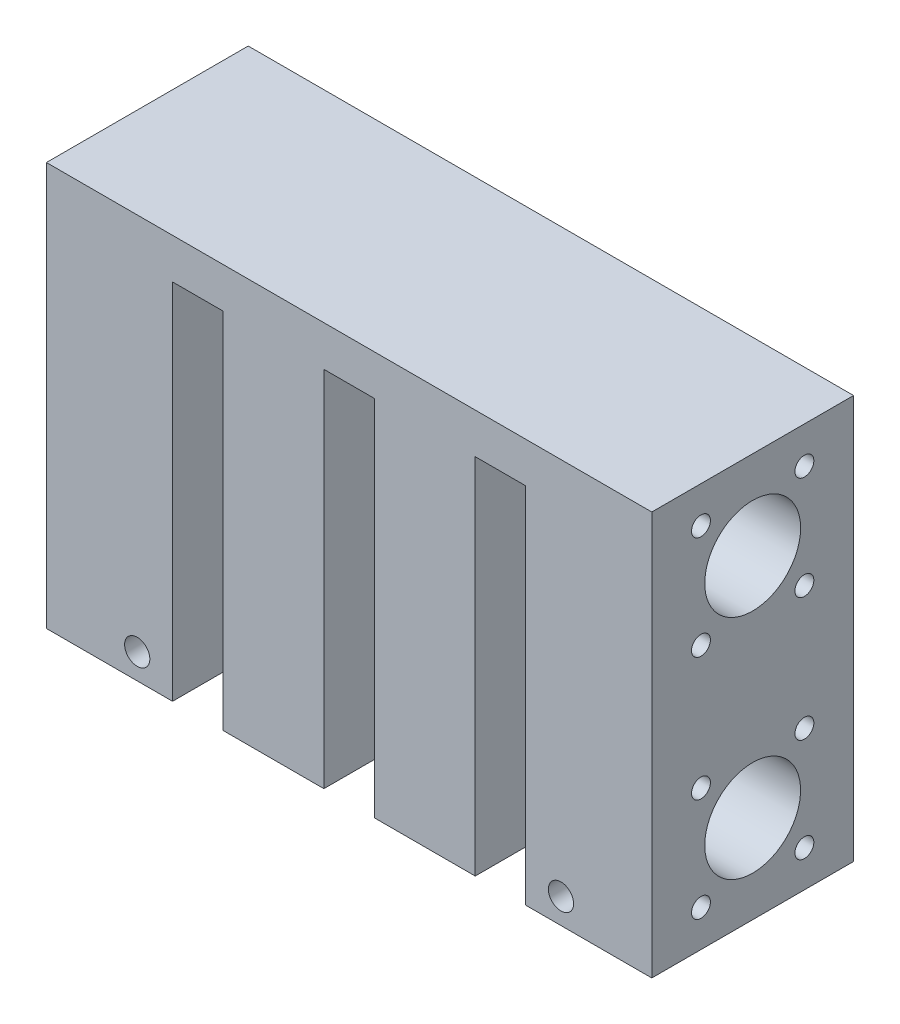
from build123d import *

# Parameters (mm, degrees)
SKETCH1_W                        = 120
SKETCH1_H                        = 80
BOSS_EXTRUDE1_DEPTH              = 40
SKETCH2_R                        = 1.85
LINEAR_BEARING_SCREW_CUTS_DEPTH  = 14
SKETCH3_R                        = 9.5
LINEAR_BEARINGS_HOLE_DEPTH       = 55
SKETCH4_R                        = 1.875
LINEAR_BEARING_SCREW_CUTS2_DEPTH = 14
CUT_EXTRUDE4_START               = -55
SKETCH5_R                        = 9.5
CUT_EXTRUDE4_DEPTH               = 55
SKETCH10_W                       = 10
SKETCH10_H                       = 10
CUT_EXTRUDE8_DEPTH               = 72
SKETCH11_R                       = 6
CUT_EXTRUDE9_DEPTH               = 111.566721937
SKETCH13_R                       = 2.5
CUT_EXTRUDE11_DEPTH              = 150.666295471


with BuildPart() as part:
    # Sketch1 → Boss-Extrude1 (new body)
    with BuildSketch(Plane.XY):
        with Locations((60, 40)):
            Rectangle(SKETCH1_W, SKETCH1_H)
    extrude(amount=BOSS_EXTRUDE1_DEPTH)

    # Sketch2 → linear-bearing-screw-cuts (cut)
    with BuildSketch(Plane.ZY):
        with Locations((30.25, 72.75)):
            Circle(SKETCH2_R)
        with Locations((9.75, 72.75)):
            Circle(SKETCH2_R)
        with Locations((30.25, 52.25)):
            Circle(SKETCH2_R)
        with Locations((9.75, 52.25)):
            Circle(SKETCH2_R)
        with Locations((9.75, 27.75)):
            Circle(SKETCH2_R)
        with Locations((30.25, 27.75)):
            Circle(SKETCH2_R)
        with Locations((30.25, 7.25)):
            Circle(SKETCH2_R)
        with Locations((9.75, 7.25)):
            Circle(SKETCH2_R)
    extrude(amount=-LINEAR_BEARING_SCREW_CUTS_DEPTH, mode=Mode.SUBTRACT)

    # Sketch3 → linear-bearings-hole (cut)
    with BuildSketch(Plane.ZY):
        with Locations((20, 62.5)):
            Circle(SKETCH3_R)
        with Locations((20, 17.5)):
            Circle(SKETCH3_R)
    extrude(amount=-LINEAR_BEARINGS_HOLE_DEPTH, mode=Mode.SUBTRACT)

    # Sketch4 → linear-bearing-screw-cuts2 (cut)
    with BuildSketch(Plane(origin=(120, 0, 0), x_dir=(0, 0, -1), z_dir=(1, 0, 0))):
        with Locations((-9.75, 72.75)):
            Circle(SKETCH4_R)
        with Locations((-30.25, 72.75)):
            Circle(SKETCH4_R)
        with Locations((-9.75, 52.25)):
            Circle(SKETCH4_R)
        with Locations((-30.25, 52.25)):
            Circle(SKETCH4_R)
        with Locations((-30.25, 27.75)):
            Circle(SKETCH4_R)
        with Locations((-9.75, 27.75)):
            Circle(SKETCH4_R)
        with Locations((-9.75, 7.25)):
            Circle(SKETCH4_R)
        with Locations((-30.25, 7.25)):
            Circle(SKETCH4_R)
    extrude(amount=-LINEAR_BEARING_SCREW_CUTS2_DEPTH, mode=Mode.SUBTRACT)

    # Sketch5 → Cut-Extrude4 (cut)
    with BuildSketch(Plane(origin=(120, 0, 0), x_dir=(0, 0, -1), z_dir=(1, 0, 0)).offset(CUT_EXTRUDE4_START)):
        with Locations((-20, 62.5)):
            Circle(SKETCH5_R)
        with Locations((-20, 17.5)):
            Circle(SKETCH5_R)
    extrude(amount=CUT_EXTRUDE4_DEPTH, mode=Mode.SUBTRACT)

    # Sketch10 → Cut-Extrude8 (cut)
    with BuildSketch(Plane.XZ):
        with Locations((90, 35)):
            Rectangle(SKETCH10_W, SKETCH10_H)
        with Locations((60, 35)):
            Rectangle(SKETCH10_W, SKETCH10_H)
        with Locations((30, 35)):
            Rectangle(SKETCH10_W, SKETCH10_H)
    extrude(amount=-CUT_EXTRUDE8_DEPTH, mode=Mode.SUBTRACT)

    # Sketch11 → Cut-Extrude9 (cut, through all)
    with BuildSketch(Plane(origin=(65, 0, 0), x_dir=(0, 0, -1), z_dir=(1, 0, 0))):
        with Locations((-20, 62.5)):
            Circle(SKETCH11_R)
        with Locations((-20, 17.5)):
            Circle(SKETCH11_R)
    extrude(amount=-CUT_EXTRUDE9_DEPTH, mode=Mode.SUBTRACT)

    # Sketch13 → Cut-Extrude11 (cut, through all)
    with BuildSketch(Plane(origin=(0, 0, 0), x_dir=(-1, 0, 0), z_dir=(0, 0, -1))):
        with Locations((-102, 5)):
            Circle(SKETCH13_R)
        with Locations((-18, 5)):
            Circle(SKETCH13_R)
    extrude(amount=-CUT_EXTRUDE11_DEPTH, mode=Mode.SUBTRACT)


solid = part.part
